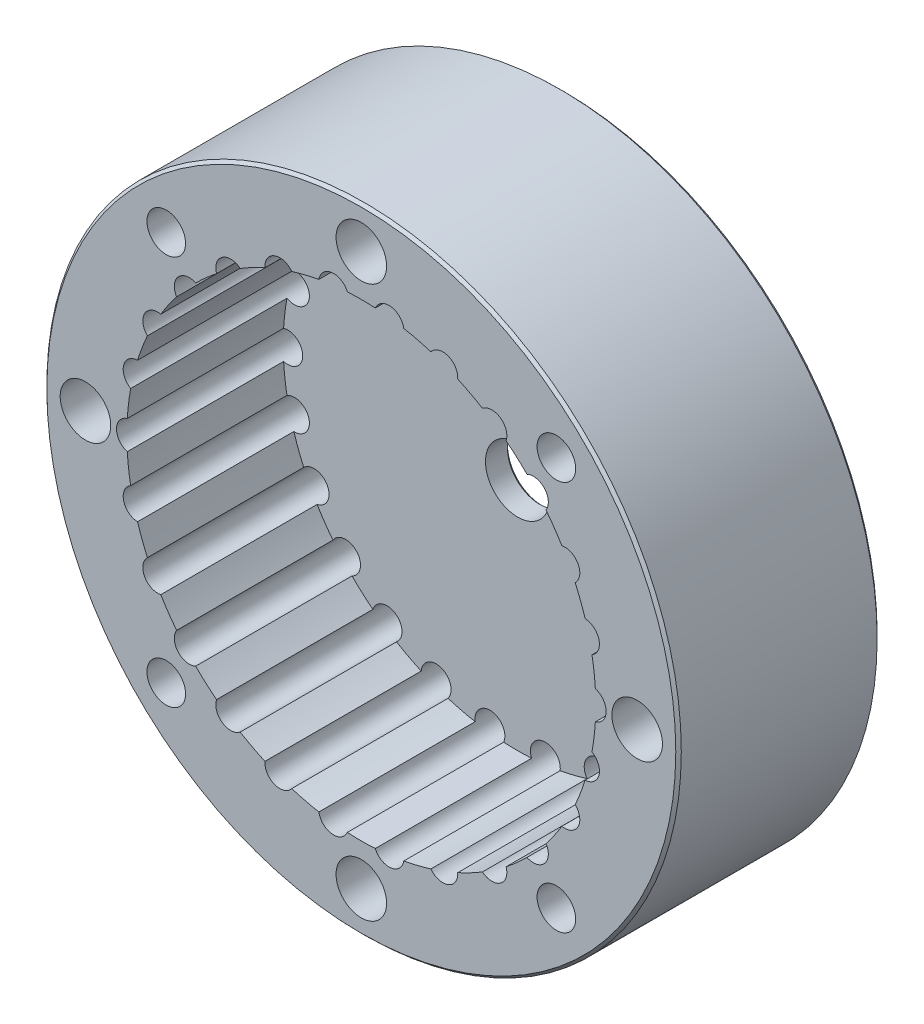
from build123d import *

# Parameters (mm, degrees)
SKETCH1_R               = 34.5
SKETCH1_R_2             = 25.5
BOSS_EXTRUDE2_DEPTH     = 17
BOSS_EXTRUDE3_START     = -5
SKETCH1_3_R             = 34.5
BOSS_EXTRUDE3_DEPTH     = 5
CUT_EXTRUDE4_DEPTH      = 52.667204298
CUT_EXTRUDE4_DEPTH_BACK = 3
SKETCH1_5_R             = 1.625
CUT_EXTRUDE6_DEPTH      = 52.667204298
CUT_EXTRUDE6_DEPTH_BACK = 52.667204298
SKETCH3_R               = 1.7
SKETCH3_R_2             = 3.5
SKETCH4_R               = 10
CUT_EXTRUDE7_DEPTH      = 2.3
SKETCH6_R               = 2.1
CUT_EXTRUDE8_DEPTH      = 10
SKETCH7_R               = 2.75
CUT_EXTRUDE9_DEPTH      = 10
CHAMFER1_SIZE           = 0.4
CHAMFER2_SIZE           = 0.3
CHAMFER3_SIZE           = 0.4
CHAMFER4_SIZE           = 0.3


with BuildPart() as part:
    # Sketch1 → Boss-Extrude2 (new body)
    with BuildSketch(Plane.XY):
        Circle(SKETCH1_R)
        Circle(SKETCH1_R_2, mode=Mode.SUBTRACT)
    extrude(amount=BOSS_EXTRUDE2_DEPTH)

    # Sketch1<3> → Boss-Extrude3 (add)
    with BuildSketch(Plane.XY.offset(BOSS_EXTRUDE3_START)):
        Circle(SKETCH1_3_R)
    extrude(amount=BOSS_EXTRUDE3_DEPTH)

    # Sketch1<5> → Cut-Extrude4 (cut, two sides: drawn at the far end of the back side and taken through both)
    with BuildSketch(Plane.XY.offset(-CUT_EXTRUDE4_DEPTH_BACK)):
        with Locations((25, 0)):
            Circle(SKETCH1_5_R)
        with Locations((24.273545436, -5.982891607)):
            Circle(SKETCH1_5_R)
        with Locations((22.136400641, -11.618079301)):
            Circle(SKETCH1_5_R)
        with Locations((18.712768704, -16.578066456)):
            Circle(SKETCH1_5_R)
        with Locations((14.201618668, -20.574596647)):
            Circle(SKETCH1_5_R)
        with Locations((8.865122176, -23.375406067)):
            Circle(SKETCH1_5_R)
        with Locations((3.013417006, -24.817721852)):
            Circle(SKETCH1_5_R)
        with Locations((-3.013417006, -24.817721852)):
            Circle(SKETCH1_5_R)
        with Locations((-8.865122176, -23.375406067)):
            Circle(SKETCH1_5_R)
        with Locations((-14.201618668, -20.574596647)):
            Circle(SKETCH1_5_R)
        with Locations((-18.712768704, -16.578066456)):
            Circle(SKETCH1_5_R)
        with Locations((-22.136400641, -11.618079301)):
            Circle(SKETCH1_5_R)
        with Locations((-24.273545436, -5.982891607)):
            Circle(SKETCH1_5_R)
        with Locations((-25, 0)):
            Circle(SKETCH1_5_R)
        with Locations((-24.273545436, 5.982891607)):
            Circle(SKETCH1_5_R)
        with Locations((-22.136400641, 11.618079301)):
            Circle(SKETCH1_5_R)
        with Locations((-18.712768704, 16.578066456)):
            Circle(SKETCH1_5_R)
        with Locations((-14.201618668, 20.574596647)):
            Circle(SKETCH1_5_R)
        with Locations((-8.865122176, 23.375406067)):
            Circle(SKETCH1_5_R)
        with Locations((-3.013417006, 24.817721852)):
            Circle(SKETCH1_5_R)
        with Locations((3.013417006, 24.817721852)):
            Circle(SKETCH1_5_R)
        with Locations((8.865122176, 23.375406067)):
            Circle(SKETCH1_5_R)
        with Locations((14.201618668, 20.574596647)):
            Circle(SKETCH1_5_R)
        with Locations((18.712768704, 16.578066456)):
            Circle(SKETCH1_5_R)
        with Locations((22.136400641, 11.618079301)):
            Circle(SKETCH1_5_R)
        with Locations((24.273545436, 5.982891607)):
            Circle(SKETCH1_5_R)
    extrude(amount=CUT_EXTRUDE4_DEPTH + CUT_EXTRUDE4_DEPTH_BACK, mode=Mode.SUBTRACT)

    # Sketch3 → Cut-Extrude6 (cut, two sides: drawn at the far end of the back side and taken through both)
    with BuildSketch(Plane.XY.offset(-CUT_EXTRUDE6_DEPTH_BACK)):
        with Locations((0, 30)):
            Circle(SKETCH3_R)
        with Locations((30, 0)):
            Circle(SKETCH3_R)
        with Locations((0, -30)):
            Circle(SKETCH3_R)
        with Locations((-30, 0)):
            Circle(SKETCH3_R)
        Circle(SKETCH3_R_2)
    extrude(amount=CUT_EXTRUDE6_DEPTH + CUT_EXTRUDE6_DEPTH_BACK, mode=Mode.SUBTRACT)

    # Sketch4 → Cut-Extrude7 (cut)
    with BuildSketch(Plane(origin=(0, 0, -5), x_dir=(-1, 0, 0), z_dir=(0, 0, -1))):
        Circle(SKETCH4_R)
    extrude(amount=-CUT_EXTRUDE7_DEPTH, mode=Mode.SUBTRACT)

    # Sketch6 → Cut-Extrude8 (cut)
    with BuildSketch(Plane.XY.offset(17)):
        with Locations((-21.213203436, 21.213203436)):
            Circle(SKETCH6_R)
        with Locations((21.213203436, 21.213203436)):
            Circle(SKETCH6_R)
        with Locations((21.213203436, -21.213203436)):
            Circle(SKETCH6_R)
        with Locations((-21.213203436, -21.213203436)):
            Circle(SKETCH6_R)
    extrude(amount=-CUT_EXTRUDE8_DEPTH, mode=Mode.SUBTRACT)

    # Sketch7 → Cut-Extrude9 (cut)
    with BuildSketch(Plane.XY.offset(17)):
        with Locations((0, 30)):
            Circle(SKETCH7_R)
        with Locations((30, 0)):
            Circle(SKETCH7_R)
        with Locations((0, -30)):
            Circle(SKETCH7_R)
        with Locations((-30, 0)):
            Circle(SKETCH7_R)
    extrude(amount=-CUT_EXTRUDE9_DEPTH, mode=Mode.SUBTRACT)

    # Chamfer1
    chamfer1_edges = [part.edges().sort_by_distance(p)[0] for p in [
        (10, 0, -5),
        (-1.7, -30, -5),
        (-31.7, 0, -5),
        (28.3, 0, -5),
        (-1.7, 30, -5),
    ]]
    chamfer(chamfer1_edges, length=CHAMFER1_SIZE)

    # Chamfer2
    chamfer2_edges = [part.edges().sort_by_distance(p)[0] for p in [
        (-3.5, 0, -2.7),
    ]]
    chamfer(chamfer2_edges, length=CHAMFER2_SIZE)

    # Chamfer3
    chamfer3_edges = [part.edges().sort_by_distance(p)[0] for p in [
        (-34.5, 0, -5),
    ]]
    chamfer(chamfer3_edges, length=CHAMFER3_SIZE)

    # Chamfer4
    chamfer4_edges = [part.edges().sort_by_distance(p)[0] for p in [
        (-34.5, 0, 17),
    ]]
    chamfer(chamfer4_edges, length=CHAMFER4_SIZE)


solid = part.part
